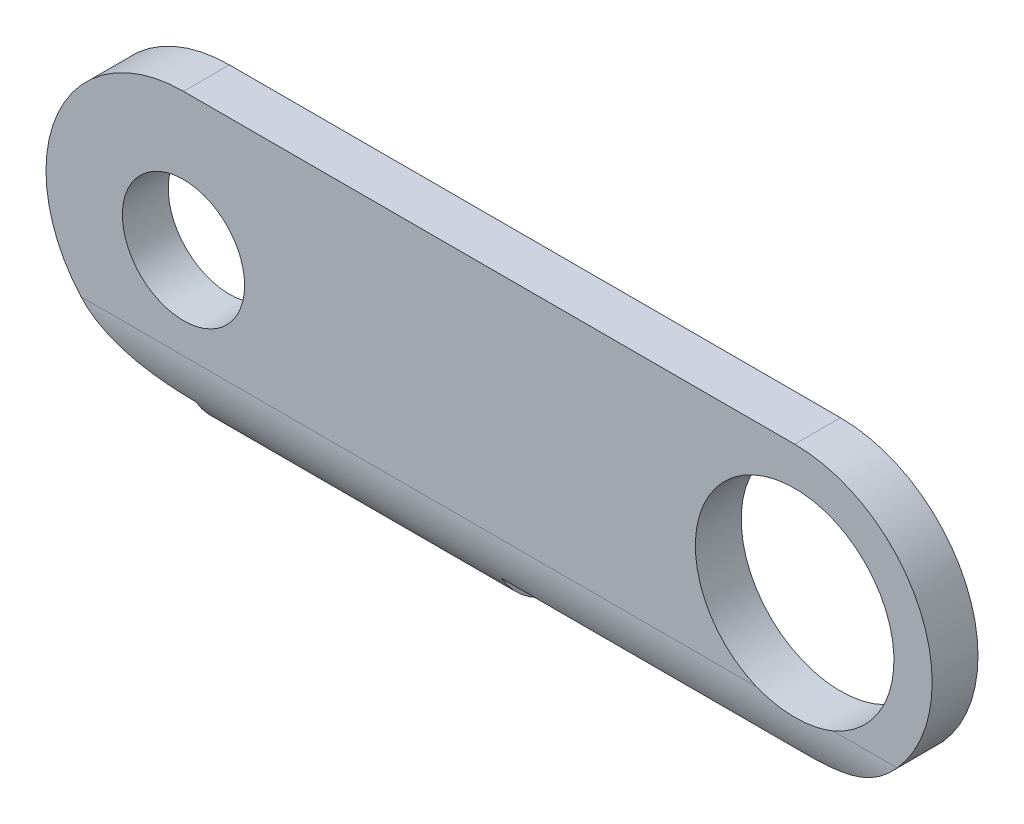
from build123d import *

# Parameters (mm, degrees)
ESQUISSE1_R        = 3.25
ESQUISSE1_R_2      = 2
BOSS_EXTRU_1_DEPTH = 1.5
ESQUISSE2_W        = 10
ESQUISSE2_H        = 1.5
BOSS_EXTRU_2_DEPTH = 6
CONG_1_START       = -20
CONG_1_DEPTH       = 10
CONG_1_START_2     = -6
CONG_1_2_DEPTH     = 1.5
CONG_1_START_3     = -24.5
CONG_1_3_DEPTH     = 29


with BuildPart() as part:
    # Esquisse1 → Boss.-Extru.1 (new body)
    with BuildSketch(Plane.XY):
        with BuildLine():
            Line((0, -4.5), (-20, -4.5))
            ThreePointArc((-20, -4.5), (-24.5, 0), (-20, 4.5))
            Line((-20, 4.5), (0, 4.5))
            ThreePointArc((0, 4.5), (4.5, 0), (0, -4.5))
        make_face()
        Circle(ESQUISSE1_R, mode=Mode.SUBTRACT)
        with Locations((-20, 0)):
            Circle(ESQUISSE1_R_2, mode=Mode.SUBTRACT)
    extrude(amount=BOSS_EXTRU_1_DEPTH)

    # Esquisse2 → Boss.-Extru.2 (add)
    with BuildSketch(Plane.XY.offset(1.5)):
        with Locations((-15, -5.25)):
            Rectangle(ESQUISSE2_W, ESQUISSE2_H)
    extrude(amount=-BOSS_EXTRU_2_DEPTH)

    # Congé1: read off the stored shape, not the designer's step
    # Congé1 outline → Congé1 (add)
    with BuildSketch(Plane.YZ.offset(CONG_1_START)):
        with BuildLine():
            ThreePointArc((-4.5, -1.5), (-4.060660172, -0.439339828), (-3, 0))
            Line((-3, 0), (-4.5, 0))
            Line((-4.5, 0), (-4.5, -1.5))
        make_face()
    extrude(amount=CONG_1_DEPTH)

    # Cong_1 2 outline → Cong_1 2 (cut)
    with BuildSketch(Plane(origin=(0, 0, 0), x_dir=(1, 0, 0), z_dir=(0, 1, 0)).offset(CONG_1_START_2)):
        with BuildLine():
            ThreePointArc((-20, 3.5), (-19.707106781, 4.207106781), (-19, 4.5))
            Line((-19, 4.5), (-20, 4.5))
            Line((-20, 4.5), (-20, 3.5))
        make_face()
        with BuildLine():
            ThreePointArc((-11, 4.5), (-10.292893219, 4.207106781), (-10, 3.5))
            Line((-10, 3.5), (-10, 4.5))
            Line((-10, 4.5), (-11, 4.5))
        make_face()
    extrude(amount=CONG_1_2_DEPTH, mode=Mode.SUBTRACT)

    # Cong_1 3 outline → Cong_1 3 (cut)
    with BuildSketch(Plane.YZ.offset(CONG_1_START_3)):
        with BuildLine():
            ThreePointArc((-6, -1.5), (-5.121320344, 0.621320344), (-3, 1.5))
            Line((-3, 1.5), (-6, 1.5))
            Line((-6, 1.5), (-6, -1.5))
        make_face()
    extrude(amount=CONG_1_3_DEPTH, mode=Mode.SUBTRACT)


solid = part.part
